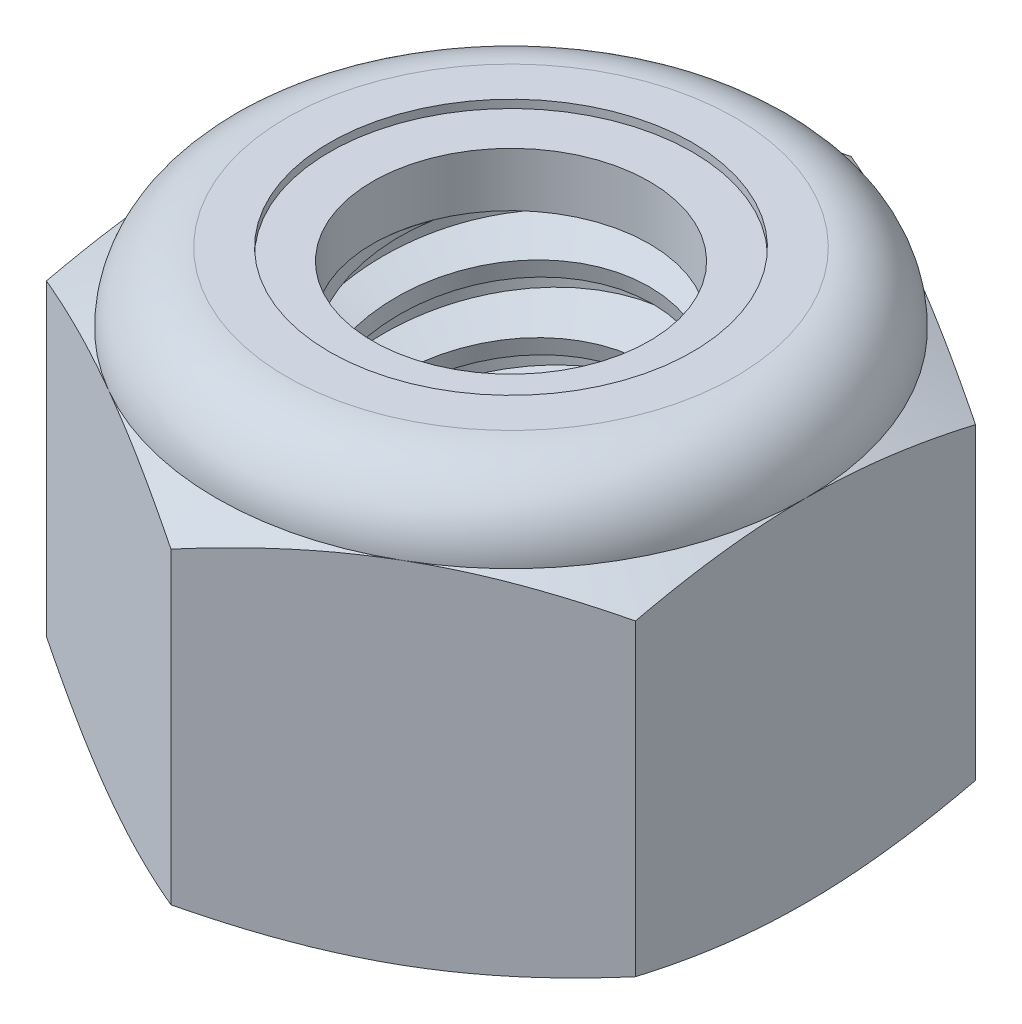
from build123d import *

# Parameters (mm, degrees)
EXTRUDE1_DEPTH       = 7.9375
SKETCH2_W            = 3.175
SKETCH2_H            = 7.9375
LPATTERN1_COUNT      = 6
LPATTERN1_PITCH      = 1.27
LPATTERN1_COUNT_DIR2 = 2
LPATTERN1_PITCH_DIR2 = 1.27


with BuildPart() as part:
    # Sketch1 → Extrude1 (new body)
    with BuildSketch(Plane(origin=(0, 0, 0), x_dir=(1, 0, 0), z_dir=(0, 1, 0))):
        Polygon((0, 6.415804866), (-5.55625, 3.207902433), (-5.55625, -3.207902433), (0, -6.415804866), (5.55625, -3.207902433), (5.55625, 3.207902433), align=None)
    extrude(amount=EXTRUDE1_DEPTH)

    # Sketch4 → Cut-Revolve2 (revolve, cut)
    with BuildSketch(Plane(origin=(0, 0, 0), x_dir=(0, 0, -1), z_dir=(1, 0, 0))):
        Polygon((0, 7.9375), (3.175, 7.9375), (2.609908356, 7.673993439), (2.609908356, 0.263506561), (3.175, 0), (0, 0), align=None)
    revolve(axis=Axis((0, 7.9375, 0), (0, 1, 0)), mode=Mode.SUBTRACT)


with BuildPart() as body_2:
    # Sketch2 → Revolve1 (revolve)
    with BuildSketch(Plane(origin=(0, 0, 0), x_dir=(0, 0, -1), z_dir=(1, 0, 0))):
        with Locations((1.5875, 3.96875)):
            Rectangle(SKETCH2_W, SKETCH2_H)
    revolve(axis=Axis((0, -3.175, 0), (0, 1, 0)))

    # Sketch3 → Cut-Revolve1 (revolve, cut)
    with BuildSketch(Plane(origin=(0, 0, 0), x_dir=(0, 0, -1), z_dir=(1, 0, 0))):
        Polygon((3.206133436, 7.781832818), (3.424067492, 6.692162542), (2.672175229, 6.946518763), (2.609908356, 7.257853128), align=None)
    cut_revolve1 = revolve(axis=Axis((0, 7.9375, 0.272704483), (0, -0.9805806756909202, -0.19611613513818404)), mode=Mode.SUBTRACT)

    # LPattern1: Cut-Revolve1 6 × 2
    with Locations(*[Vector(0, -1, 0) * (i * LPATTERN1_PITCH) + Vector(0, 1, 0) * (j * LPATTERN1_PITCH_DIR2) for i in range(LPATTERN1_COUNT) for j in range(LPATTERN1_COUNT_DIR2) if (i, j) != (0, 0)]):
        add(cut_revolve1, mode=Mode.SUBTRACT)


with BuildPart() as part_1:
    add(part.part)

    # Combine1: cut body 2
    add(body_2.part, mode=Mode.SUBTRACT)

    # Sketch5 → Cut-Revolve3 (revolve, cut)
    with BuildSketch(Plane(origin=(0, 0, 0), x_dir=(0, 0, -1), z_dir=(1, 0, 0))):
        with BuildLine():
            Line((0, 0), (5.55625, 0))
            Line((5.55625, 0), (6.415804866, 0.400817017))
            Line((6.415804866, 0.400817017), (6.415804866, 6.213766317))
            Line((6.415804866, 6.213766317), (5.55625, 6.614583333))
            ThreePointArc((5.55625, 6.614583333), (5.168776679, 7.550026679), (4.233333333, 7.9375))
            Line((4.233333333, 7.9375), (4.233333333, 9.2075))
            Line((4.233333333, 9.2075), (7.685804866, 9.2075))
            Line((7.685804866, 9.2075), (7.685804866, -1.27))
            Line((7.685804866, -1.27), (0, -1.27))
            Line((0, -1.27), (0, 0))
        make_face()
    revolve(axis=Axis((0, 0, 0), (0, 1, 0)), mode=Mode.SUBTRACT)

    # Sketch6 → Cut-Revolve4 (revolve, cut)
    with BuildSketch(Plane(origin=(0, 0, 0), x_dir=(0, 0, -1), z_dir=(1, 0, 0))):
        with BuildLine():
            Line((0, 6.614583333), (5.40385, 6.614583333))
            ThreePointArc((5.40385, 6.614583333), (5.061013606, 7.442263606), (4.233333333, 7.7851))
            Line((4.233333333, 7.7851), (3.421620845, 7.7851))
            Line((3.421620845, 7.7851), (3.421620845, 9.2075))
            Line((3.421620845, 9.2075), (0, 9.2075))
            Line((0, 9.2075), (0, 6.614583333))
        make_face()
    revolve(axis=Axis((0, 9.2075, 0), (0, 1, 0)), mode=Mode.SUBTRACT)


with BuildPart() as body_2_2:
    # Sketch7 → Revolve2 (revolve)
    with BuildSketch(Plane(origin=(0, 0, 0), x_dir=(0, 0, -1), z_dir=(1, 0, 0))):
        with BuildLine():
            Line((2.609908356, 6.690783333), (5.324993778, 6.690783333))
            ThreePointArc((5.324993778, 6.690783333), (4.979705237, 7.4148695), (4.233333333, 7.7089))
            Line((4.233333333, 7.7089), (2.609908356, 7.7089))
            Line((2.609908356, 7.7089), (2.609908356, 6.690783333))
        make_face()
    revolve(axis=Axis((0, 6.690783333, 0), (0, 1, 0)))


solid = Compound([part_1.part, body_2_2.part])
